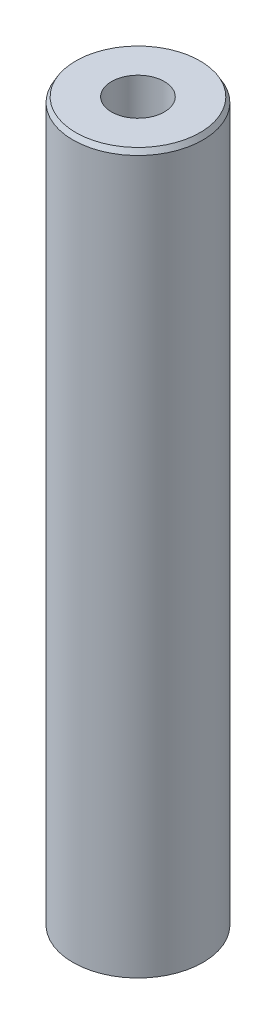
from build123d import *
from OCP.BRepFilletAPI import BRepFilletAPI_MakeChamfer

# Parameters (mm, degrees)
SKETCH1_R           = 10
BOSS_EXTRUDE1_DEPTH = 110.780177898
SKETCH2_R           = 4.062544868
CUT_EXTRUDE1_DEPTH  = 112.679218368
CHAMFER1_SIZE       = 0.764176746
CHAMFER1_SIZE2      = 0.44119765


with BuildPart() as part:
    # Sketch1 → Boss-Extrude1 (new body)
    with BuildSketch(Plane(origin=(0, 0, 0), x_dir=(1, 0, 0), z_dir=(0, 1, 0))):
        Circle(SKETCH1_R)
    extrude(amount=BOSS_EXTRUDE1_DEPTH)

    # Sketch2 → Cut-Extrude1 (cut, through all)
    with BuildSketch(Plane(origin=(0, 0, 0), x_dir=(1, 0, 0), z_dir=(0, 1, 0))):
        Circle(SKETCH2_R)
    extrude(amount=CUT_EXTRUDE1_DEPTH, mode=Mode.SUBTRACT)

    # Chamfer1: one chamfer whose edges measure the first distance from different faces: ONE call of the kernel's chamfer builder (chamfer() names one face for all edges)
    chamfer1_edges_1 = [part.edges().sort_by_distance(p)[0] for p in [
        (-10, 110.780177898, 0),
    ]]
    chamfer1_side_1 = [part.faces().sort_by_distance(p)[0] for p in [
        (-10, 55.390088949, 0),
    ]]
    chamfer1_edges_2 = [part.edges().sort_by_distance(p)[0] for p in [
        (-10, 0, 0),
    ]]
    chamfer1_side_2 = [part.faces().sort_by_distance(p)[0] for p in [
        (-9.717157288, 0, 0),
    ]]
    chamfer1 = BRepFilletAPI_MakeChamfer(part.part.solid().wrapped)
    for e in chamfer1_edges_1:
        chamfer1.Add(CHAMFER1_SIZE, CHAMFER1_SIZE2, e.wrapped, chamfer1_side_1[0].wrapped)  # the first distance lies on this face
    for e in chamfer1_edges_2:
        chamfer1.Add(CHAMFER1_SIZE, CHAMFER1_SIZE2, e.wrapped, chamfer1_side_2[0].wrapped)  # the first distance lies on this face
    add(Compound.cast(chamfer1.Shape()), mode=Mode.REPLACE)


solid = part.part
